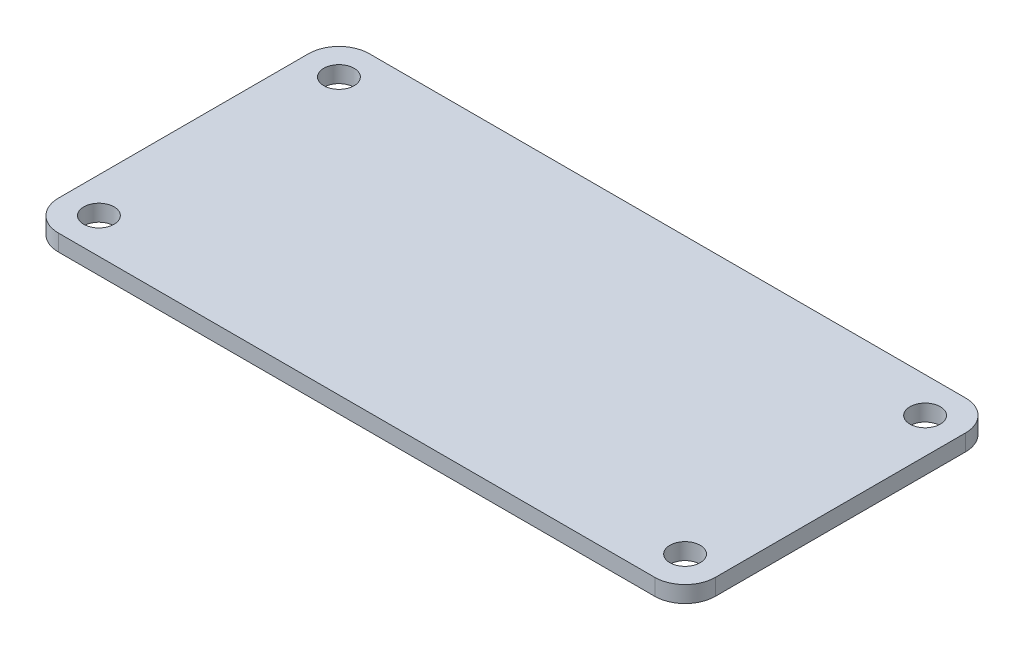
from build123d import *

# Parameters (mm, degrees)
EXTRUDE_1_DEPTH     = 1.63
SKETCH_2_R          = 1.5
CUT_EXTRUDE_1_DEPTH = 36.99024208
SKETCH_8_W          = 51
SKETCH_8_H          = 5
EXTRUDE_6_DEPTH     = 3.68


with BuildPart() as part:
    # 草图1 → 凸台-拉伸1 (new body)
    with BuildSketch(Plane(origin=(0, 0, 0), x_dir=(1, 0, 0), z_dir=(0, 1, 0))):
        with BuildLine():
            Line((-29.5, 15.375), (29.5, 15.375))
            ThreePointArc((29.5, 15.375), (31.621320344, 14.496320344), (32.5, 12.375))
            Line((32.5, 12.375), (32.5, -12.375))
            ThreePointArc((32.5, -12.375), (31.621320344, -14.496320344), (29.5, -15.375))
            Line((29.5, -15.375), (-29.5, -15.375))
            ThreePointArc((-29.5, -15.375), (-31.621320344, -14.496320344), (-32.5, -12.375))
            Line((-32.5, -12.375), (-32.5, 12.375))
            ThreePointArc((-32.5, 12.375), (-31.621320344, 14.496320344), (-29.5, 15.375))
        make_face()
    extrude(amount=EXTRUDE_1_DEPTH)

    # 草图2 → 切除-拉伸1 (cut, through all)
    with BuildSketch(Plane(origin=(0, 1.63, 0), x_dir=(1, 0, 0), z_dir=(0, 1, 0))):
        with Locations((-29, 11.875)):
            Circle(SKETCH_2_R)
        with Locations((-29, -11.875)):
            Circle(SKETCH_2_R)
        with Locations((29, -11.875)):
            Circle(SKETCH_2_R)
        with Locations((29, 11.875)):
            Circle(SKETCH_2_R)
    extrude(amount=-CUT_EXTRUDE_1_DEPTH, mode=Mode.SUBTRACT)

    # 草图8 → 凸台-拉伸6 (add)
    with BuildSketch(Plane.XZ):
        with Locations((-0.2, -11.235)):
            Rectangle(SKETCH_8_W, SKETCH_8_H)
    extrude(amount=EXTRUDE_6_DEPTH)


solid = part.part
